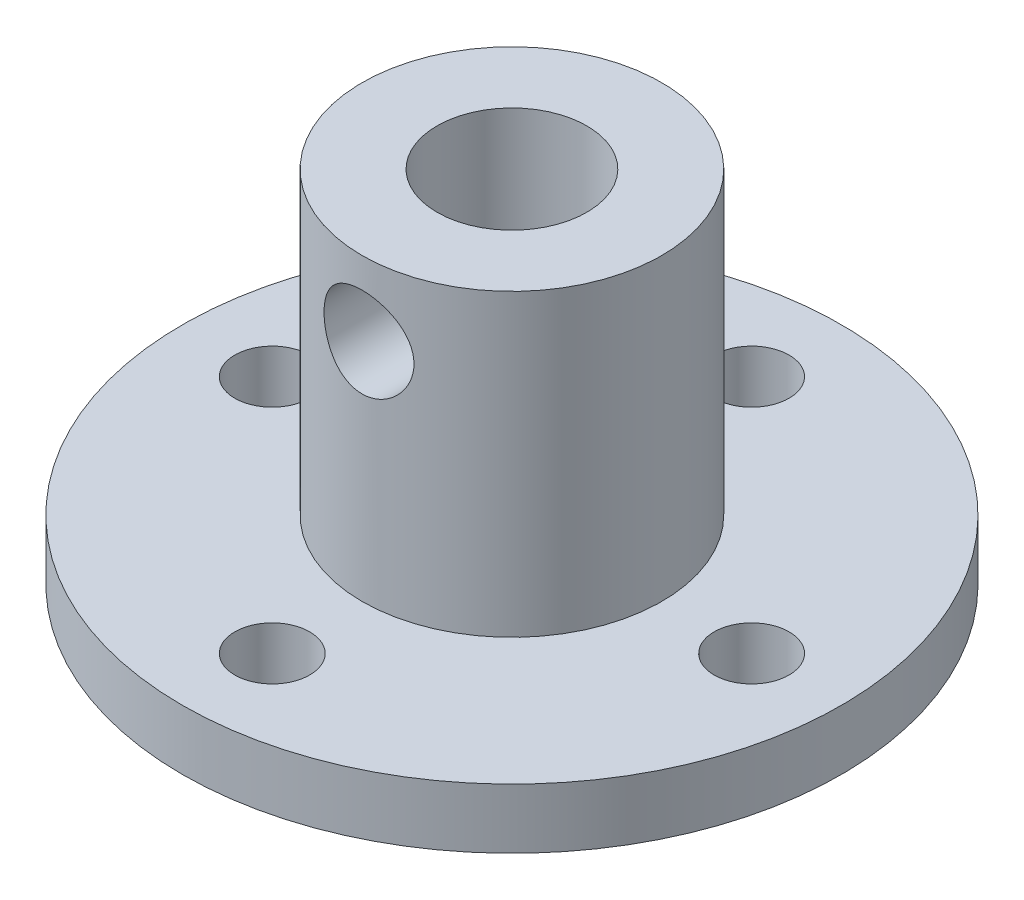
from build123d import *

# Parameters (mm, degrees)
SKETCH_1_R          = 11
SKETCH_1_R_2        = 1.25
EXTRUDE_1_DEPTH     = 2
SKETCH_2_R          = 5
SKETCH_2_R_2        = 2.5
EXTRUDE_2_DEPTH     = 10
CUT_EXTRUDE_1_REACH = 21.647
SKETCH_3_R          = 1.5


with BuildPart() as part:
    # 草圖1 → 填料-伸長1 (new body)
    with BuildSketch(Plane(origin=(0, 0, 0), x_dir=(1, 0, 0), z_dir=(0, 1, 0))):
        Circle(SKETCH_1_R)
        with Locations((0, 8)):
            Circle(SKETCH_1_R_2, mode=Mode.SUBTRACT)
        with Locations((8, 0)):
            Circle(SKETCH_1_R_2, mode=Mode.SUBTRACT)
        with Locations((0, -8)):
            Circle(SKETCH_1_R_2, mode=Mode.SUBTRACT)
        with Locations((-8, 0)):
            Circle(SKETCH_1_R_2, mode=Mode.SUBTRACT)
    extrude(amount=EXTRUDE_1_DEPTH)

    # 草圖2 → 填料-伸長2 (add)
    with BuildSketch(Plane(origin=(0, 2, 0), x_dir=(1, 0, 0), z_dir=(0, 1, 0))):
        Circle(SKETCH_2_R)
        Circle(SKETCH_2_R_2, mode=Mode.SUBTRACT)
    extrude(amount=EXTRUDE_2_DEPTH)

    # 草圖3 → 除料-伸長1 (cut, up to next)
    with BuildSketch(Plane.XY, mode=Mode.PRIVATE) as cut_extrude_1_sk1:
        with Locations((0, 9.5)):
            Circle(SKETCH_3_R)
    cut_extrude_1_tool1 = extrude(cut_extrude_1_sk1.sketch, amount=CUT_EXTRUDE_1_REACH, mode=Mode.PRIVATE) & part.part
    add(cut_extrude_1_tool1.solids().sort_by_distance((0, 9.5, 0))[0], mode=Mode.SUBTRACT)


solid = part.part
